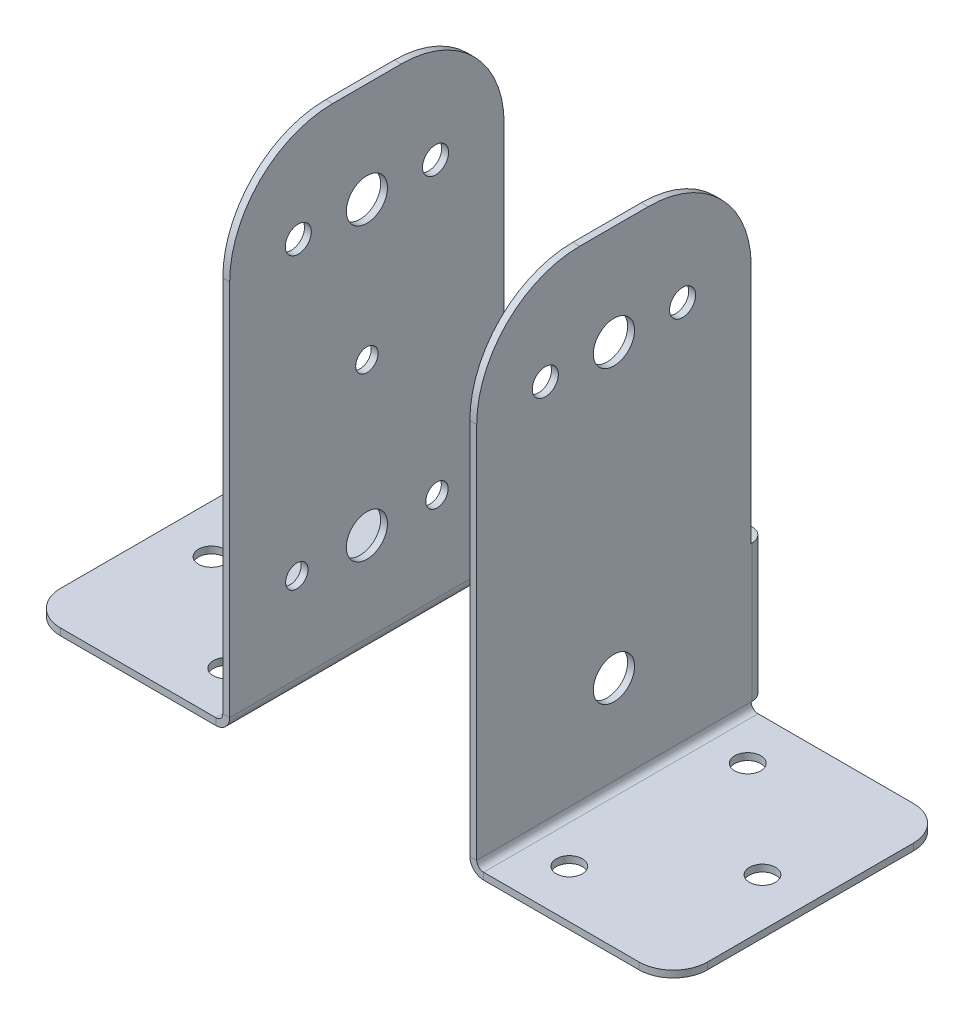
from build123d import *

# Parameters (mm, degrees)
BASE_FLANGE1_DEPTH         = 1
SKETCHED_START             = -40
SKETCHED_BEND3_OUTLINE_W   = 40
SKETCHED_BEND3_OUTLINE_H   = 1
SKETCHED_BEND3_DEPTH       = 28.18876
SKETCHED_START_2           = -11.4496
SKETCHED_BEND3_2_DEPTH     = 0.4496
SKETCHED_START_3           = -12
SKETCHED_BEND3_3_DEPTH     = 2
SKETCHED_START_4           = -60
SKETCHED_BEND3_4_DEPTH     = 120
SKETCHED_BEND7_DEPTH       = 72
SKETCHED_START_5           = -10
SKETCHED_BEND7_2_OUTLINE_W = 1
SKETCHED_BEND7_2_OUTLINE_H = 40
SKETCHED_BEND7_2_DEPTH     = 55
SKETCHED_BEND7_3_DEPTH     = 20
SKETCHED_BEND7_4_DEPTH     = 2
SKETCHED_START_6           = 45
SKETCHED_BEND7_5_OUTLINE_W = 1
SKETCHED_BEND7_5_OUTLINE_H = 40
SKETCHED_BEND7_5_DEPTH     = 15
SKETCHED_START_7           = 1.14380551
SKETCHED_BEND7_6_DEPTH     = 40
SKETCHED_START_8           = -42.14380551
SKETCHED_BEND7_7_DEPTH     = 84.28761102
SKETCH9_R                  = 3
CUT_EXTRUDE1_DEPTH         = 98.989397047
F_4_CLEARANCE_HOLE1_D      = 3.2639
F_4_CLEARANCE_HOLE1_DEPTH  = 10
F_4_CLEARANCE_HOLE1_TIP    = 0.980574487
F_6_CLEARANCE_HOLE1_D      = 3.7973
F_6_CLEARANCE_HOLE2_D      = 3.7973


with BuildPart() as part:
    # Base-Flange1: sheet metal written as solids
    # Sketch1 → Base-Flange1 (new body)
    with BuildSketch(Plane.XY):
        with BuildLine():
            Line((-19, -10), (-19, -35))
            ThreePointArc((-19, -35), (-20.464466094, -38.535533906), (-24, -40))
            Line((-24, -40), (-54, -40))
            ThreePointArc((-54, -40), (-57.535533906, -38.535533906), (-59, -35))
            Line((-59, -35), (-59, 45))
            ThreePointArc((-59, 45), (-54.606601718, 55.606601718), (-44, 60))
            Line((-44, 60), (-34, 60))
            ThreePointArc((-34, 60), (-23.393398282, 55.606601718), (-19, 45))
            Line((-19, 45), (-19, 10))
            Line((-19, 10), (19, 10))
            Line((19, 10), (19, 45))
            ThreePointArc((19, 45), (23.393398282, 55.606601718), (34, 60))
            Line((34, 60), (44, 60))
            ThreePointArc((44, 60), (54.606601718, 55.606601718), (59, 45))
            Line((59, 45), (59, -35))
            ThreePointArc((59, -35), (57.535533906, -38.535533906), (54, -40))
            Line((54, -40), (24, -40))
            ThreePointArc((24, -40), (20.464466094, -38.535533906), (19, -35))
            Line((19, -35), (19, -10))
            Line((19, -10), (-19, -10))
        make_face()
    extrude(amount=-BASE_FLANGE1_DEPTH)

    # Sketched Bend3: read off the stored shape, not the designer's step
    # Sketched Bend3 outline → Sketched Bend3 (cut)
    with BuildSketch(Plane(origin=(0, 0, 0), x_dir=(1, 0, 0), z_dir=(0, 1, 0)).offset(SKETCHED_START)):
        with Locations((-39, 0.5)):
            Rectangle(SKETCHED_BEND3_OUTLINE_W, SKETCHED_BEND3_OUTLINE_H)
        with Locations((39, 0.5)):
            Rectangle(SKETCHED_BEND3_OUTLINE_W, SKETCHED_BEND3_OUTLINE_H)
    extrude(amount=SKETCHED_BEND3_DEPTH, mode=Mode.SUBTRACT)

    # Sketched Bend3 2 outline → Sketched Bend3 2 (add)
    with BuildSketch(Plane(origin=(0, 0, 0), x_dir=(1, 0, 0), z_dir=(0, 1, 0)).offset(SKETCHED_START_2)):
        with BuildLine():
            Line((-19, 1), (-19, 24.64380551))
            ThreePointArc((-19, 24.64380551), (-20.464466094, 28.179339416), (-24, 29.64380551))
            Line((-24, 29.64380551), (-54, 29.64380551))
            ThreePointArc((-54, 29.64380551), (-57.535533906, 28.179339416), (-59, 24.64380551))
            Line((-59, 24.64380551), (-59, 1))
            Line((-59, 1), (-19, 1))
        make_face()
        with BuildLine():
            Line((19, 24.64380551), (19, 1))
            Line((19, 1), (59, 1))
            Line((59, 1), (59, 24.64380551))
            ThreePointArc((59, 24.64380551), (57.535533906, 28.179339416), (54, 29.64380551))
            Line((54, 29.64380551), (24, 29.64380551))
            ThreePointArc((24, 29.64380551), (20.464466094, 28.179339416), (19, 24.64380551))
        make_face()
    extrude(amount=SKETCHED_BEND3_2_DEPTH)

    # Sketched Bend3 3 outline → Sketched Bend3 3 (add)
    with BuildSketch(Plane(origin=(0, 0, 0), x_dir=(1, 0, 0), z_dir=(0, 1, 0)).offset(SKETCHED_START_3)):
        with BuildLine():
            Line((-19, 1), (-19, 24.64380551))
            ThreePointArc((-19, 24.64380551), (-20.464466094, 28.179339416), (-24, 29.64380551))
            Line((-24, 29.64380551), (-54, 29.64380551))
            ThreePointArc((-54, 29.64380551), (-57.535533906, 28.179339416), (-59, 24.64380551))
            Line((-59, 24.64380551), (-59, 1))
            Line((-59, 1), (-19, 1))
        make_face()
        with BuildLine():
            ThreePointArc((59, 24.64380551), (57.535533906, 28.179339416), (54, 29.64380551))
            Line((54, 29.64380551), (24, 29.64380551))
            ThreePointArc((24, 29.64380551), (20.464466094, 28.179339416), (19, 24.64380551))
            Line((19, 24.64380551), (19, 1))
            Line((19, 1), (59, 1))
            Line((59, 1), (59, 24.64380551))
        make_face()
    extrude(amount=SKETCHED_BEND3_3_DEPTH)

    # Sketched Bend3 4 outline → Sketched Bend3 4 (cut)
    with BuildSketch(Plane.YZ.offset(SKETCHED_START_4)):
        with BuildLine():
            Line((-11, -2), (-11, -29.64380551))
            Line((-11, -29.64380551), (-10, -29.64380551))
            Line((-10, -29.64380551), (-10, -1))
            ThreePointArc((-10, -1), (-10.707106781, -1.292893219), (-11, -2))
        make_face()
        with BuildLine():
            Line((-12, -1), (-12, -2))
            ThreePointArc((-12, -2), (-11.414213562, -0.585786438), (-10, 0))
            Line((-10, 0), (-11.81124, 0))
            Line((-11.81124, 0), (-11.81124, -1))
            Line((-11.81124, -1), (-12, -1))
        make_face()
    extrude(amount=SKETCHED_BEND3_4_DEPTH, mode=Mode.SUBTRACT)

    # Sketched Bend7: read off the stored shape, not the designer's step
    # Sketched Bend7 outline → Sketched Bend7 (cut)
    with BuildSketch(Plane(origin=(0, 0, 0), x_dir=(1, 0, 0), z_dir=(0, 1, 0)).offset(SKETCHED_START_3)):
        with BuildLine():
            ThreePointArc((-18.232050807, 0), (-17.5, 0.732050807), (-16.5, 1))
            Line((-16.5, 1), (-19, 1))
            Line((-19, 1), (-19, 24.64380551))
            ThreePointArc((-19, 24.64380551), (-20.464466094, 28.179339416), (-24, 29.64380551))
            Line((-24, 29.64380551), (-54, 29.64380551))
            ThreePointArc((-54, 29.64380551), (-57.535533906, 28.179339416), (-59, 24.64380551))
            Line((-59, 24.64380551), (-59, 0))
            Line((-59, 0), (-18.232050807, 0))
        make_face()
        with BuildLine():
            Line((19, 1), (16.5, 1))
            ThreePointArc((16.5, 1), (17.5, 0.732050807), (18.232050807, 0))
            Line((18.232050807, 0), (59, 0))
            Line((59, 0), (59, 24.64380551))
            ThreePointArc((59, 24.64380551), (57.535533906, 28.179339416), (54, 29.64380551))
            Line((54, 29.64380551), (24, 29.64380551))
            ThreePointArc((24, 29.64380551), (20.464466094, 28.179339416), (19, 24.64380551))
            Line((19, 24.64380551), (19, 1))
        make_face()
    extrude(amount=SKETCHED_BEND7_DEPTH, mode=Mode.SUBTRACT)



with BuildPart() as body_2:
    # Sketched Bend7 2 outline → Sketched Bend7 2 (new body)
    with BuildSketch(Plane(origin=(0, 0, 0), x_dir=(1, 0, 0), z_dir=(0, 1, 0)).offset(SKETCHED_START_5)):
        with Locations((-18, -21.14380551)):
            Rectangle(SKETCHED_BEND7_2_OUTLINE_W, SKETCHED_BEND7_2_OUTLINE_H)
        with Locations((18, -21.14380551)):
            Rectangle(SKETCHED_BEND7_2_OUTLINE_W, SKETCHED_BEND7_2_OUTLINE_H)
    extrude(amount=SKETCHED_BEND7_2_DEPTH)


with BuildPart() as part_1:
    add(part.part)

    add(body_2.part)  # Sketched Bend7 3 merges body 2
    # Sketched Bend7 3 outline → Sketched Bend7 3 (add)
    with BuildSketch(Plane(origin=(0, 0, 0), x_dir=(1, 0, 0), z_dir=(0, 1, 0)).offset(SKETCHED_START_5)):
        with BuildLine():
            Line((-16.5, 0), (-18.232050807, 0))
            ThreePointArc((-18.232050807, 0), (-18.431851652, -0.48236191), (-18.5, -1))
            Line((-18.5, -1), (-18.5, -1.14380551))
            Line((-18.5, -1.14380551), (-17.5, -1.14380551))
            Line((-17.5, -1.14380551), (-17.5, -1))
            ThreePointArc((-17.5, -1), (-17.207106781, -0.292893219), (-16.5, 0))
        make_face()
        with BuildLine():
            ThreePointArc((18.5, -1), (18.431851652, -0.48236191), (18.232050807, 0))
            Line((18.232050807, 0), (16.5, 0))
            ThreePointArc((16.5, 0), (17.207106781, -0.292893219), (17.5, -1))
            Line((17.5, -1), (17.5, -1.14380551))
            Line((17.5, -1.14380551), (18.5, -1.14380551))
            Line((18.5, -1.14380551), (18.5, -1))
        make_face()
    extrude(amount=SKETCHED_BEND7_3_DEPTH)

    # Sketched Bend7 4 outline → Sketched Bend7 4 (add)
    with BuildSketch(Plane(origin=(0, 0, 0), x_dir=(1, 0, 0), z_dir=(0, 1, 0)).offset(SKETCHED_START_3)):
        with BuildLine():
            ThreePointArc((-47.14380551, -36.14380551), (-45.679339416, -39.679339416), (-42.14380551, -41.14380551))
            Line((-42.14380551, -41.14380551), (-17.5, -41.14380551))
            Line((-17.5, -41.14380551), (-17.5, -1.14380551))
            Line((-17.5, -1.14380551), (-42.14380551, -1.14380551))
            ThreePointArc((-42.14380551, -1.14380551), (-45.679339416, -2.608271604), (-47.14380551, -6.14380551))
            Line((-47.14380551, -6.14380551), (-47.14380551, -36.14380551))
        make_face()
        with BuildLine():
            ThreePointArc((42.14380551, -41.14380551), (45.679339416, -39.679339416), (47.14380551, -36.14380551))
            Line((47.14380551, -36.14380551), (47.14380551, -6.14380551))
            ThreePointArc((47.14380551, -6.14380551), (45.679339416, -2.608271604), (42.14380551, -1.14380551))
            Line((42.14380551, -1.14380551), (17.5, -1.14380551))
            Line((17.5, -1.14380551), (17.5, -41.14380551))
            Line((17.5, -41.14380551), (42.14380551, -41.14380551))
        make_face()
    extrude(amount=SKETCHED_BEND7_4_DEPTH)

    # Sketched Bend7 5 outline → Sketched Bend7 5 (add)
    with BuildSketch(Plane(origin=(0, 0, 0), x_dir=(1, 0, 0), z_dir=(0, 1, 0)).offset(SKETCHED_START_6)):
        with Locations((-18, -21.14380551)):
            Rectangle(SKETCHED_BEND7_5_OUTLINE_W, SKETCHED_BEND7_5_OUTLINE_H)
        with Locations((18, -21.14380551)):
            Rectangle(SKETCHED_BEND7_5_OUTLINE_W, SKETCHED_BEND7_5_OUTLINE_H)
    extrude(amount=SKETCHED_BEND7_5_DEPTH)

    # Sketched Bend7 6 outline → Sketched Bend7 6 (cut)
    with BuildSketch(Plane.XY.offset(SKETCHED_START_7)):
        with BuildLine():
            Line((-47.14380551, -11), (-19.5, -11))
            ThreePointArc((-19.5, -11), (-18.792893219, -10.707106781), (-18.5, -10))
            Line((-18.5, -10), (-47.14380551, -10))
            Line((-47.14380551, -10), (-47.14380551, -11))
        make_face()
        with BuildLine():
            ThreePointArc((-17.5, -10), (-18.085786438, -11.414213562), (-19.5, -12))
            Line((-19.5, -12), (-17.5, -12))
            Line((-17.5, -12), (-17.5, -10))
        make_face()
        with BuildLine():
            Line((19.5, -11), (47.14380551, -11))
            Line((47.14380551, -11), (47.14380551, -10))
            Line((47.14380551, -10), (18.5, -10))
            ThreePointArc((18.5, -10), (18.792893219, -10.707106781), (19.5, -11))
        make_face()
        with BuildLine():
            Line((17.5, -12), (19.5, -12))
            ThreePointArc((19.5, -12), (18.085786438, -11.414213562), (17.5, -10))
            Line((17.5, -10), (17.5, -12))
        make_face()
    extrude(amount=SKETCHED_BEND7_6_DEPTH, mode=Mode.SUBTRACT)

    # Sketched Bend7 7 outline → Sketched Bend7 7 (cut)
    with BuildSketch(Plane.YZ.offset(SKETCHED_START_8)):
        with BuildLine():
            ThreePointArc((45, 41.14380551), (55.606601718, 36.750407228), (60, 26.14380551))
            Line((60, 26.14380551), (60, 41.14380551))
            Line((60, 41.14380551), (45, 41.14380551))
        make_face()
        with BuildLine():
            ThreePointArc((60, 16.14380551), (55.606601718, 5.537203792), (45, 1.14380551))
            Line((45, 1.14380551), (60, 1.14380551))
            Line((60, 1.14380551), (60, 16.14380551))
        make_face()
    extrude(amount=SKETCHED_BEND7_7_DEPTH, mode=Mode.SUBTRACT)

    # Sketch9 → Cut-Extrude1 (cut, through all)
    with BuildSketch(Plane.ZY.offset(18.5)):
        with Locations(Location((21.14380551, 3, 0), (0, 0, 180))):
            Circle(SKETCH9_R)
        with Locations(Location((21.14380551, 45.4, 0), (0, 0, 180))):
            Circle(SKETCH9_R)
    extrude(amount=-CUT_EXTRUDE1_DEPTH, mode=Mode.SUBTRACT)

    # #4 Clearance Hole1
    with Locations(Plane.ZY.offset(18.5)):
        with Locations((10.93300551, 3), (31.35460551, 3), (21.14380551, 25.1742)):
            Hole(F_4_CLEARANCE_HOLE1_D / 2, depth=F_4_CLEARANCE_HOLE1_DEPTH)
            with Locations((0, 0, -(F_4_CLEARANCE_HOLE1_DEPTH + F_4_CLEARANCE_HOLE1_TIP / 2))):  # 118° drill point
                Cone(0, F_4_CLEARANCE_HOLE1_D / 2, F_4_CLEARANCE_HOLE1_TIP, mode=Mode.SUBTRACT)

    # #6 Clearance Hole1 (through all)
    with Locations(Plane.ZY.offset(18.5)):
        with Locations((11.14380551, 45.4), (31.14380551, 45.4)):
            Hole(F_6_CLEARANCE_HOLE1_D / 2)

    # #6 Clearance Hole2 (through all)
    with Locations(Plane(origin=(0, -11, 0), x_dir=(1, 0, 0), z_dir=(0, 1, 0))):
        with Locations((-40.14380551, -21.14380551), (-25, -34.14380551), (25, -34.14380551), (40.14380551, -21.14380551), (-25, -8.14380551), (25, -8.14380551)):
            Hole(F_6_CLEARANCE_HOLE2_D / 2)


solid = part_1.part
